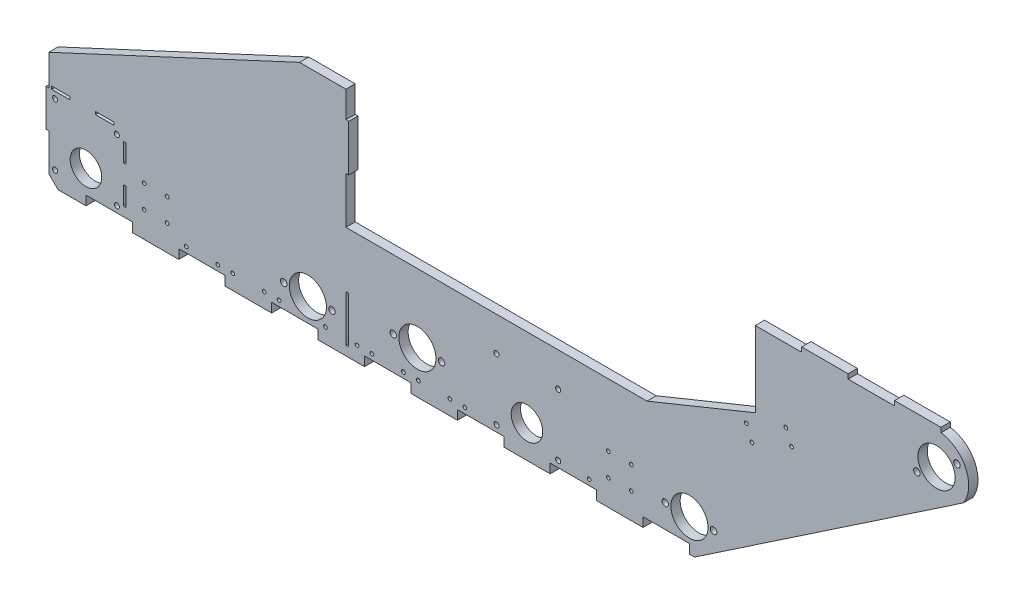
from build123d import *

# Parameters (mm, degrees)
SKETCH_1_R          = 2.75
SKETCH_1_R_2        = 17
SKETCH_1_R_3        = 20
SKETCH_1_R_4        = 3.5
SKETCH_1_R_5        = 2
SKETCH_1_W          = 20
SKETCH_1_H          = 3
SKETCH_1_W_2        = 3.160774411
SKETCH_1_H_2        = 20
SKETCH_1_W_3        = 3
SKETCH_1_H_3        = 50
EXTRUDE_1_DEPTH     = 10
EXTRUDE_3_DEPTH     = 10
SKETCH_3_R          = 2
CUT_EXTRUDE_1_DEPTH = 999.435971659


with BuildPart() as part:
    # 스케치1 → 보스-돌출1 (new body)
    with BuildSketch(Plane.XY):
        with BuildLine():
            Line((5.267585072, -97.655469737), (35.301603788, -97.655469737))
            Line((35.301603788, -97.655469737), (35.301603788, -87.655469737))
            Line((35.301603788, -87.655469737), (85.301603788, -87.655469737))
            Line((85.301603788, -87.655469737), (85.301603788, -97.655469737))
            Line((85.301603788, -97.655469737), (85.305622503, -97.655469737))
            Line((85.305622503, -97.655469737), (135.297585072, -97.655469737))
            Line((135.297585072, -97.655469737), (135.301603788, -97.655469737))
            Line((135.301603788, -97.655469737), (135.301603788, -87.655469737))
            Line((135.301603788, -87.655469737), (185.301603788, -87.655469737))
            Line((185.301603788, -87.655469737), (185.301603788, -97.655469737))
            Line((185.301603788, -97.655469737), (231.531603788, -97.655469737))
            Line((231.531603788, -97.655469737), (235.301603788, -97.655469737))
            Line((235.301603788, -97.655469737), (235.301603788, -87.655469737))
            Line((235.301603788, -87.655469737), (285.301603788, -87.655469737))
            Line((285.301603788, -87.655469737), (285.301603788, -97.655469737))
            Line((285.301603788, -97.655469737), (335.301603788, -97.655469737))
            Line((335.301603788, -97.655469737), (335.301603788, -87.655469737))
            Line((335.301603788, -87.655469737), (385.301603788, -87.655469737))
            Line((385.301603788, -87.655469737), (385.301603788, -97.655469737))
            Line((385.301603788, -97.655469737), (435.301603788, -97.655469737))
            Line((435.301603788, -97.655469737), (435.301603788, -87.655469737))
            Line((435.301603788, -87.655469737), (485.301603788, -87.655469737))
            Line((485.301603788, -87.655469737), (485.301603788, -97.655469737))
            Line((485.301603788, -97.655469737), (535.301603788, -97.655469737))
            Line((535.301603788, -97.655469737), (535.301603788, -87.655469737))
            Line((535.301603788, -87.655469737), (585.301603788, -87.655469737))
            Line((585.301603788, -87.655469737), (585.301603788, -97.655469737))
            Line((585.301603788, -97.655469737), (635.301603788, -97.655469737))
            Line((635.301603788, -97.655469737), (635.301603788, -87.655469737))
            Line((635.301603788, -87.655469737), (685.301603788, -87.655469737))
            Line((685.301603788, -87.655469737), (685.301603788, -97.655469737))
            Line((685.301603788, -97.655469737), (690.631109923, -97.655469737))
            Line((690.631109923, -97.655469737), (980.385244165, 97.7861616))
            ThreePointArc((980.385244165, 97.7861616), (983.008498199, 131.143098655), (956.214221814, 151.183893662))
            Line((956.214221814, 151.183893662), (639.593248415, 22.344530263))
            Line((639.593248415, 22.344530263), (315.301603788, 22.344530263))
            Line((315.301603788, 22.344530263), (315.301603788, 72.661637882))
            Line((315.301603788, 72.661637882), (318.301603788, 72.661637882))
            Line((318.301603788, 72.661637882), (318.301603788, 122.661637882))
            Line((318.301603788, 122.661637882), (315.301603788, 122.661637882))
            Line((315.301603788, 122.661637882), (315.301603788, 146.501001281))
            Line((315.301603788, 146.501001281), (315.301603788, 151.183893662))
            Line((315.301603788, 151.183893662), (265.299669923, 151.183893662))
            Line((265.299669923, 151.183893662), (-4.732414928, 25.58459835))
            Line((-4.732414928, 25.58459835), (-4.732414928, -7.689488453))
            Line((-4.732414928, -7.689488453), (-7.732414928, -7.689488453))
            Line((-7.732414928, -7.689488453), (-7.732414928, -47.689488453))
            Line((-7.732414928, -47.689488453), (-4.732414928, -47.689488453))
            Line((-4.732414928, -47.689488453), (-4.732414928, -87.655469737))
            Line((-4.732414928, -87.655469737), (5.267585072, -97.655469737))
        make_face()
        with Locations((2.067585072, -80.890469737)):
            Circle(SKETCH_1_R, mode=Mode.SUBTRACT)
        with Locations((2.067585072, -14.422432305)):
            Circle(SKETCH_1_R, mode=Mode.SUBTRACT)
        with Locations((68.535622503, -14.422432305)):
            Circle(SKETCH_1_R, mode=Mode.SUBTRACT)
        with Locations((68.535622503, -80.890469737)):
            Circle(SKETCH_1_R, mode=Mode.SUBTRACT)
        with Locations((35.301603788, -62.655469737)):
            Circle(SKETCH_1_R_2, mode=Mode.SUBTRACT)
        with Locations((685.301603788, -62.655469737)):
            Circle(SKETCH_1_R_3, mode=Mode.SUBTRACT)
        with Locations((951.422664578, 116.845452277)):
            Circle(SKETCH_1_R_3, mode=Mode.SUBTRACT)
        with Locations((973.404213264, 130.731110971)):
            Circle(SKETCH_1_R_4, mode=Mode.SUBTRACT)
        with Locations((930.301497775, 101.683120237)):
            Circle(SKETCH_1_R_4, mode=Mode.SUBTRACT)
        with Locations((274.301603788, -62.655469737)):
            Circle(SKETCH_1_R_3, mode=Mode.SUBTRACT)
        with Locations((248.301603788, -62.655469737)):
            Circle(SKETCH_1_R_4, mode=Mode.SUBTRACT)
        with Locations((300.301603788, -62.655469737)):
            Circle(SKETCH_1_R_4, mode=Mode.SUBTRACT)
        with Locations((392.301603788, -51.655469737)):
            Circle(SKETCH_1_R_3, mode=Mode.SUBTRACT)
        with Locations((366.301603788, -51.655469737)):
            Circle(SKETCH_1_R_4, mode=Mode.SUBTRACT)
        with Locations((418.301603788, -51.655469737)):
            Circle(SKETCH_1_R_4, mode=Mode.SUBTRACT)
        with Locations((543.898689933, -14.422432305)):
            Circle(SKETCH_1_R, mode=Mode.SUBTRACT)
        with Locations((477.430652501, -14.422432305)):
            Circle(SKETCH_1_R, mode=Mode.SUBTRACT)
        with Locations((477.430652501, -80.890469737)):
            Circle(SKETCH_1_R, mode=Mode.SUBTRACT)
        with Locations((543.898689933, -80.890469737)):
            Circle(SKETCH_1_R, mode=Mode.SUBTRACT)
        with Locations((510.301603788, -62.655469737)):
            Circle(SKETCH_1_R_2, mode=Mode.SUBTRACT)
        with Locations((659.301603788, -62.655469737)):
            Circle(SKETCH_1_R_4, mode=Mode.SUBTRACT)
        with Locations((711.301603788, -62.655469737)):
            Circle(SKETCH_1_R_4, mode=Mode.SUBTRACT)
        with Locations((143.301603788, -81.655469737)):
            Circle(SKETCH_1_R_5, mode=Mode.SUBTRACT)
        with Locations((177.301603788, -81.655469737)):
            Circle(SKETCH_1_R_5, mode=Mode.SUBTRACT)
        with Locations((193.301603788, -81.655469737)):
            Circle(SKETCH_1_R_5, mode=Mode.SUBTRACT)
        with Locations((227.301603788, -81.655469737)):
            Circle(SKETCH_1_R_5, mode=Mode.SUBTRACT)
        with Locations((243.301603788, -81.655469737)):
            Circle(SKETCH_1_R_5, mode=Mode.SUBTRACT)
        with Locations((293.301603788, -81.655469737)):
            Circle(SKETCH_1_R_5, mode=Mode.SUBTRACT)
        with Locations((327.301603788, -81.655469737)):
            Circle(SKETCH_1_R_5, mode=Mode.SUBTRACT)
        with Locations((343.301603788, -81.655469737)):
            Circle(SKETCH_1_R_5, mode=Mode.SUBTRACT)
        with Locations((377.301603788, -81.655469737)):
            Circle(SKETCH_1_R_5, mode=Mode.SUBTRACT)
        with Locations((393.301603788, -81.655469737)):
            Circle(SKETCH_1_R_5, mode=Mode.SUBTRACT)
        with Locations((427.301603788, -81.655469737)):
            Circle(SKETCH_1_R_5, mode=Mode.SUBTRACT)
        with Locations((443.301603788, -81.655469737)):
            Circle(SKETCH_1_R_5, mode=Mode.SUBTRACT)
        with Locations((577.301603788, -81.655469737)):
            Circle(SKETCH_1_R_5, mode=Mode.SUBTRACT)
        with Locations((97.927235117, -45.281101066)):
            Circle(SKETCH_1_R_5, mode=Mode.SUBTRACT)
        with Locations((122.675972458, -45.281101066)):
            Circle(SKETCH_1_R_5, mode=Mode.SUBTRACT)
        with Locations((122.675972458, -70.029838408)):
            Circle(SKETCH_1_R_5, mode=Mode.SUBTRACT)
        with Locations((97.927235117, -70.029838408)):
            Circle(SKETCH_1_R_5, mode=Mode.SUBTRACT)
        with Locations((597.927235117, -45.281101066)):
            Circle(SKETCH_1_R_5, mode=Mode.SUBTRACT)
        with Locations((622.675972458, -45.281101066)):
            Circle(SKETCH_1_R_5, mode=Mode.SUBTRACT)
        with Locations((622.675972458, -70.029838408)):
            Circle(SKETCH_1_R_5, mode=Mode.SUBTRACT)
        with Locations((597.927235117, -70.029838408)):
            Circle(SKETCH_1_R_5, mode=Mode.SUBTRACT)
        with Locations((8.301603788, -5.922432305)):
            Rectangle(SKETCH_1_W, SKETCH_1_H, mode=Mode.SUBTRACT)
        with Locations((55.535622503, -5.922432305)):
            Rectangle(SKETCH_1_W, SKETCH_1_H, mode=Mode.SUBTRACT)
        with Locations((77.116009709, -27.422432305)):
            Rectangle(SKETCH_1_W_2, SKETCH_1_H_2, mode=Mode.SUBTRACT)
        with Locations((77.116009709, -67.655469737)):
            Rectangle(SKETCH_1_W_2, SKETCH_1_H_2, mode=Mode.SUBTRACT)
        with Locations((316.801603788, -62.655469737)):
            Rectangle(SKETCH_1_W_3, SKETCH_1_H_3, mode=Mode.SUBTRACT)
    extrude(amount=EXTRUDE_1_DEPTH)

    # 스케치2 → 보스-돌출3 (add)
    with BuildSketch(Plane.XY.offset(10)):
        Polygon((756.214221814, 151.183893662), (756.214221814, 69.799920885), (956.214221814, 151.183893662), (956.214221814, 156.183893662), (906.214221814, 156.183893662), (906.214221814, 151.183893662), (856.214221814, 151.183893662), (856.214221814, 156.183893662), (806.214221814, 156.183893662), (806.214221814, 151.183893662), align=None)
    extrude(amount=-EXTRUDE_3_DEPTH)

    # 스케치3 → 컷-돌출1 (cut, through all)
    with BuildSketch(Plane.XY.offset(10)):
        with Locations((746.563195632, 55.162355864)):
            Circle(SKETCH_3_R)
        with Locations((752.593781974, 40.342368402)):
            Circle(SKETCH_3_R)
        with Locations((789.170659585, 72.500291597)):
            Circle(SKETCH_3_R)
        with Locations((795.201245927, 57.680304135)):
            Circle(SKETCH_3_R)
    extrude(amount=-CUT_EXTRUDE_1_DEPTH, mode=Mode.SUBTRACT)


solid = part.part
